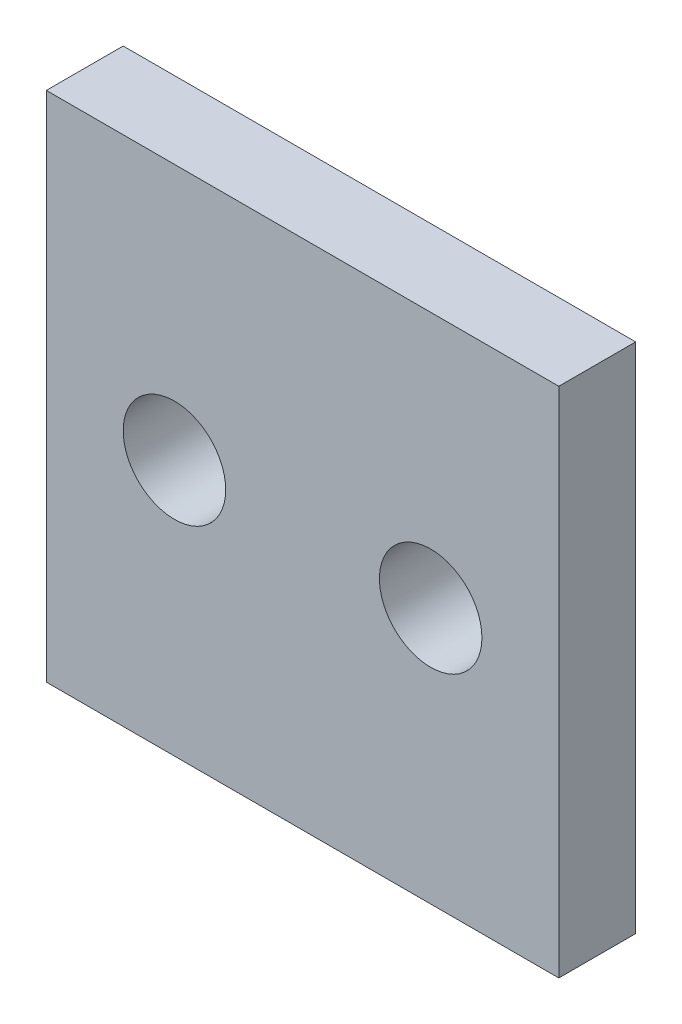
from build123d import *

# Parameters (mm, degrees)
CROQUIS1_W                   = 10
CROQUIS1_H                   = 10
CROQUIS1_R                   = 1
SALIENTE_EXTRUIR6_DEPTH      = 1.5
SALIENTE_EXTRUIR7_DEPTH      = 0.75
SALIENTE_EXTRUIR7_DEPTH_BACK = 0.75


with BuildPart() as part:
    # Croquis1 → Saliente-Extruir6 (new body)
    with BuildSketch(Plane.XY):
        Rectangle(CROQUIS1_W, CROQUIS1_H)
        with Locations((-2.5, 0)):
            Circle(CROQUIS1_R, mode=Mode.SUBTRACT)
        with Locations((2.5, 0)):
            Circle(CROQUIS1_R, mode=Mode.SUBTRACT)
    extrude(amount=SALIENTE_EXTRUIR6_DEPTH)

    # Croquis8 → Saliente-Extruir7 (add, two sides: drawn at the far end of the back side and taken through both)
    with BuildSketch(Plane(origin=(0, 0, 0), x_dir=(0, 0, -1), z_dir=(1, 0, 0)).offset(-SALIENTE_EXTRUIR7_DEPTH_BACK)):
        with BuildLine():
            Line((0, 3), (0, 1.5))
            ThreePointArc((0, 1.5), (1.5, 0), (0, -1.5))
            Line((0, -1.5), (0, -3))
            ThreePointArc((0, -3), (3, 0), (0, 3))
        make_face()
    extrude(amount=SALIENTE_EXTRUIR7_DEPTH + SALIENTE_EXTRUIR7_DEPTH_BACK)


solid = part.part
